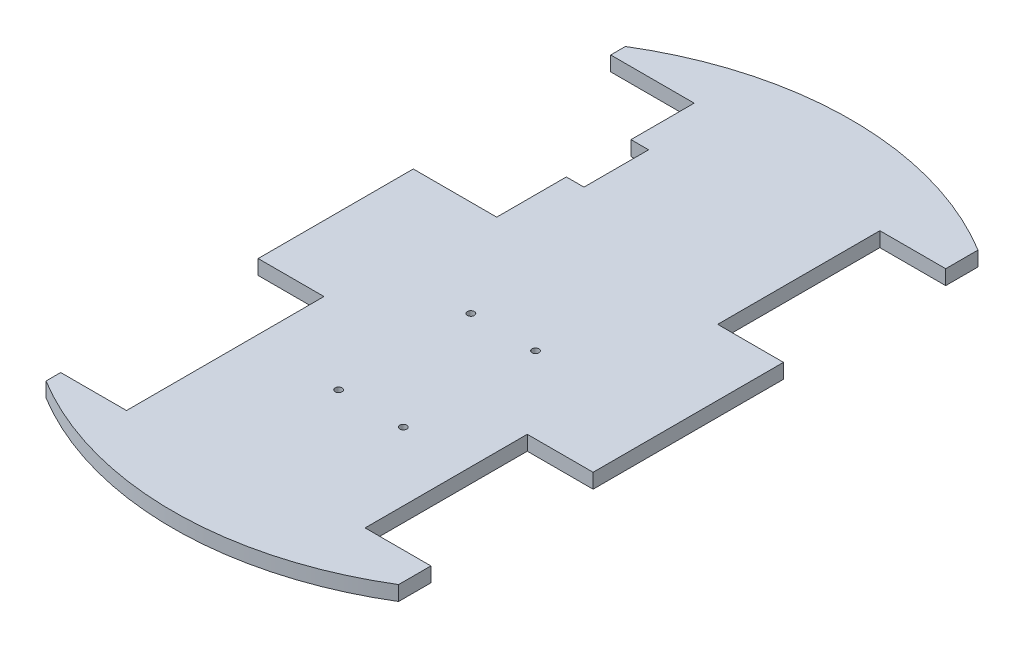
from build123d import *

# Parameters (mm, degrees)
CHASSIS_DEPTH      = 6.35
SKETCH2_R          = 1.5
CUT_EXTRUDE1_DEPTH = 12.7


with BuildPart() as part:
    # Sketch1 → Chassis (new body)
    with BuildSketch(Plane(origin=(0, 0, 0), x_dir=(1, 0, 0), z_dir=(0, 1, 0))):
        with BuildLine():
            Line((-40.132, -42.672), (-76.2, -42.672))
            Line((-76.2, -42.672), (-76.2, -109.728))
            Line((-76.2, -109.728), (-47.752, -109.728))
            Line((-47.752, -109.728), (-47.752, -195.072))
            Line((-47.752, -195.072), (-76.2, -195.072))
            Line((-76.2, -195.072), (-76.2, -201.422))
            ThreePointArc((-76.2, -201.422), (0, -222.784410099), (76.2, -201.422))
            Line((76.2, -201.422), (76.2, -187.452))
            Line((76.2, -187.452), (47.752, -187.452))
            Line((47.752, -187.452), (47.752, -117.348))
            Line((47.752, -117.348), (76.2, -117.348))
            Line((76.2, -117.348), (76.2, -35.052))
            Line((76.2, -35.052), (47.752, -35.052))
            Line((47.752, -35.052), (47.752, 35.052))
            Line((47.752, 35.052), (76.2, 35.052))
            Line((76.2, 35.052), (76.2, 49.022))
            ThreePointArc((76.2, 49.022), (0, 70.384410099), (-76.2, 49.022))
            Line((-76.2, 49.022), (-76.2, 42.672))
            Line((-76.2, 42.672), (-40.132, 42.672))
            Line((-40.132, 42.672), (-40.132, 15.353478138))
            Line((-40.132, 15.353478138), (-32.512, 15.353478138))
            Line((-32.512, 15.353478138), (-32.512, -12.586521862))
            Line((-32.512, -12.586521862), (-40.132, -12.586521862))
            Line((-40.132, -12.586521862), (-40.132, -42.672))
        make_face()
    extrude(amount=CHASSIS_DEPTH)

    # Sketch2 → Cut-Extrude1 (cut)
    with BuildSketch(Plane(origin=(0, 6.35, 0), x_dir=(1, 0, 0), z_dir=(0, 1, 0))):
        with Locations((18.288, -84.328)):
            Circle(SKETCH2_R)
        with Locations((-9.652, -84.328)):
            Circle(SKETCH2_R)
        with Locations((-9.652, -141.478)):
            Circle(SKETCH2_R)
        with Locations((18.288, -141.478)):
            Circle(SKETCH2_R)
    extrude(amount=-CUT_EXTRUDE1_DEPTH, mode=Mode.SUBTRACT)


solid = part.part
